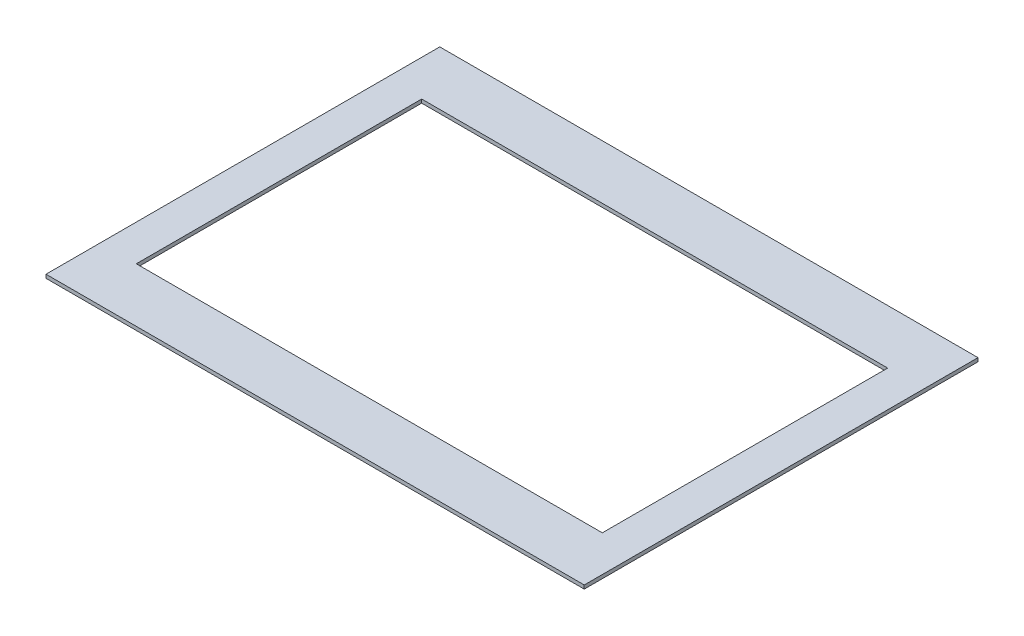
from build123d import *

# Parameters (mm, degrees)
SKETCH1_W           = 218
SKETCH1_H           = 2
BOSS_EXTRUDE1_DEPTH = 298
SKETCH2_W           = 258
SKETCH2_H           = 158
CUT_EXTRUDE1_DEPTH  = 10


with BuildPart() as part:
    # Sketch1 → Boss-Extrude1 (new body)
    with BuildSketch(Plane(origin=(0, 0, 0), x_dir=(0, 0, -1), z_dir=(1, 0, 0))):
        with Locations((82.3216851, 1)):
            Rectangle(SKETCH1_W, SKETCH1_H)
    extrude(amount=BOSS_EXTRUDE1_DEPTH)

    # Sketch2 → Cut-Extrude1 (cut)
    with BuildSketch(Plane(origin=(0, 2, 0), x_dir=(1, 0, 0), z_dir=(0, 1, 0))):
        with Locations((149, 82.3216851)):
            Rectangle(SKETCH2_W, SKETCH2_H)
    extrude(amount=-CUT_EXTRUDE1_DEPTH, mode=Mode.SUBTRACT)


solid = part.part
